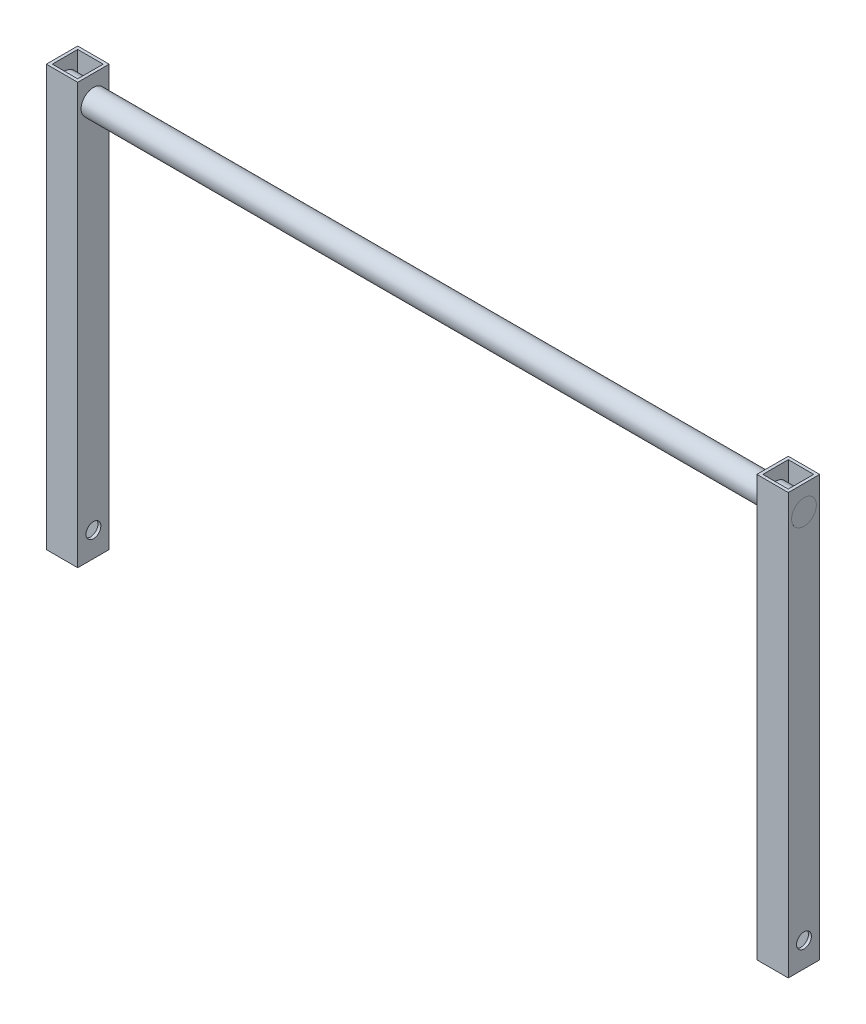
from build123d import *

# Parameters (mm, degrees)
SKETCH1_R           = 5
BOSS_EXTRUDE1_DEPTH = 150
SKETCH2_W           = 12.7
SKETCH2_H           = 170
BOSS_EXTRUDE2_DEPTH = 12.7
SHELL1_T            = -1.2
SKETCH2_3_R         = 3
SKETCH2_3_R_2       = 5
CUT_EXTRUDE1_DEPTH  = 341.059292624


with BuildPart() as part:
    # Sketch1 → Boss-Extrude1 (new, symmetric)
    with BuildSketch(Plane(origin=(0, 0, 0), x_dir=(0, 0, -1), z_dir=(1, 0, 0))):
        Circle(SKETCH1_R)
    extrude(amount=BOSS_EXTRUDE1_DEPTH, both=True)


with BuildPart() as body_2:
    # Sketch2 → Boss-Extrude2 (new body)
    with BuildSketch(Plane.ZY.offset(150)):
        with Locations((0, -75)):
            Rectangle(SKETCH2_W, SKETCH2_H)
    extrude(amount=-BOSS_EXTRUDE2_DEPTH)

    # Shell1
    shell1_openings = [body_2.faces().sort_by_distance(p)[0] for p in [
        (-143.65, 10, 0),
        (-143.65, -160, 0),
    ]]
    offset(amount=SHELL1_T, openings=shell1_openings, kind=Kind.INTERSECTION)

    # Sketch2<3> → Cut-Extrude1 (cut, through all)
    with BuildSketch(Plane.ZY.offset(150)):
        with Locations((0, -150)):
            Circle(SKETCH2_3_R)
        Circle(SKETCH2_3_R_2)
    extrude(amount=-CUT_EXTRUDE1_DEPTH, mode=Mode.SUBTRACT)


with BuildPart() as body_3:
    # Mirror1: mirrored copy
    add(body_2.part.mirror(Plane(origin=(0, 0, 0), x_dir=(0, 0, 1), z_dir=(1, 0, 0))))


solid = Compound([part.part, body_2.part, body_3.part])
